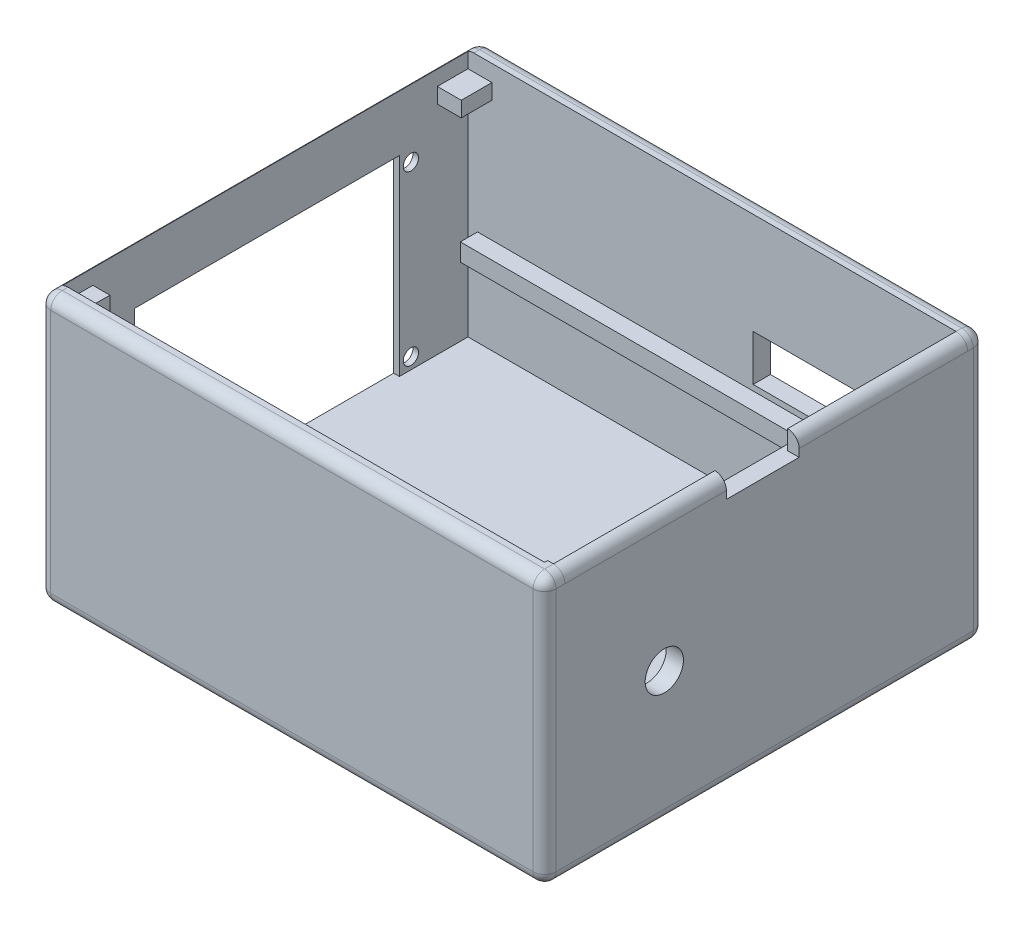
from build123d import *

# Parameters (mm, degrees)
SKETCH2_W           = 135
SKETCH2_H           = 115
SKETCH2_W_2         = 126
SKETCH2_H_2         = 106
BOSS_EXTRUDE1_DEPTH = 70
SKETCH2_2_W         = 126
SKETCH2_2_H         = 106
BOSS_EXTRUDE2_DEPTH = 5
SKETCH3_W           = 121
SKETCH3_H           = 4.584314329
BOSS_EXTRUDE3_DEPTH = 4.5
SKETCH3_3_W         = 35
SKETCH3_3_H         = 12
CUT_EXTRUDE1_DEPTH  = 148.195448299
SKETCH11_W          = 69.2
SKETCH11_H          = 50
SKETCH11_R          = 2
CUT_EXTRUDE3_DEPTH  = 26.5
SKETCH21_R          = 5
CUT_EXTRUDE7_DEPTH  = 10
SKETCH12_W          = 4.5
SKETCH12_H          = 105.171400209
CUT_EXTRUDE4_DEPTH  = 5
SKETCH15_W          = 115
SKETCH15_H          = 70
CUT_EXTRUDE6_DEPTH  = 3
SKETCH17_W          = 120.925170316
SKETCH17_H          = 4.5
BOSS_EXTRUDE5_DEPTH = 5.5
FILLET1_R           = 3
FILLET2_R           = 3
FILLET3_R           = 3
SKETCH22_W          = 3
SKETCH22_H          = 105.171400209
BOSS_EXTRUDE8_DEPTH = 5
SKETCH14_W          = 19
SKETCH14_H          = 5
CUT_EXTRUDE5_DEPTH  = 5
SKETCH19_W          = 6.24417403
SKETCH19_H          = 4
BOSS_EXTRUDE6_DEPTH = 8
SKETCH20_W          = 4.447751713
SKETCH20_H          = 10.321902288
BOSS_EXTRUDE7_DEPTH = 8
FILLET5_R           = 3
FILLET6_R           = 3


# Some blends are built 0.0001 mm under size
with BuildPart() as part:
    # Sketch2 → Boss-Extrude1 (new body)
    with BuildSketch(Plane(origin=(0, 0, 0), x_dir=(1, 0, 0), z_dir=(0, 1, 0))):
        Rectangle(SKETCH2_W, SKETCH2_H)
        Rectangle(SKETCH2_W_2, SKETCH2_H_2, mode=Mode.SUBTRACT)
    extrude(amount=BOSS_EXTRUDE1_DEPTH)

    # Sketch2<2> → Boss-Extrude2 (add)
    with BuildSketch(Plane(origin=(0, 0, 0), x_dir=(1, 0, 0), z_dir=(0, 1, 0))):
        Rectangle(SKETCH2_2_W, SKETCH2_2_H)
    extrude(amount=BOSS_EXTRUDE2_DEPTH)

    # Sketch3 → Boss-Extrude3 (add)
    with BuildSketch(Plane.XY.offset(-53)):
        with Locations((0, 27.707842836)):
            Rectangle(SKETCH3_W, SKETCH3_H)
    extrude(amount=BOSS_EXTRUDE3_DEPTH)

    # Sketch3<3> → Cut-Extrude1 (cut, through all)
    with BuildSketch(Plane.XY.offset(-53)):
        with Locations((29, 37.5)):
            Rectangle(SKETCH3_3_W, SKETCH3_3_H)
    extrude(amount=-CUT_EXTRUDE1_DEPTH, mode=Mode.SUBTRACT)

    # Sketch11 → Cut-Extrude3 (cut)
    with BuildSketch(Plane.ZY.offset(67.5)):
        with Locations((-0.5, 30)):
            Rectangle(SKETCH11_W, SKETCH11_H)
        with BuildLine():
            ThreePointArc((39.9, 8.871779789), (36.1, 8), (39.9, 7.128220211))
            Line((39.9, 7.128220211), (39.9, 8.871779789))
        make_face()
        with BuildLine():
            Line((39.9, 51.128220211), (39.9, 52.871779789))
            ThreePointArc((39.9, 52.871779789), (36.1, 52), (39.9, 51.128220211))
        make_face()
        with Locations((-38.1, 52)):
            Circle(SKETCH11_R)
        with Locations((-38.1, 8)):
            Circle(SKETCH11_R)
    extrude(amount=-CUT_EXTRUDE3_DEPTH, mode=Mode.SUBTRACT)

    # Sketch21 → Cut-Extrude7 (cut)
    with BuildSketch(Plane(origin=(67.5, 0, 0), x_dir=(0, 0, -1), z_dir=(1, 0, 0))):
        with Locations((-26.20929228, 34.316365245)):
            Circle(SKETCH21_R)
    extrude(amount=-CUT_EXTRUDE7_DEPTH, mode=Mode.SUBTRACT)

    # Sketch12 → Cut-Extrude4 (cut)
    with BuildSketch(Plane(origin=(0, 70, 0), x_dir=(1, 0, 0), z_dir=(0, 1, 0))):
        with Locations((65.25, 0.414299895)):
            Rectangle(SKETCH12_W, SKETCH12_H)
    extrude(amount=-CUT_EXTRUDE4_DEPTH, mode=Mode.SUBTRACT)

    # Sketch15 → Cut-Extrude6 (cut)
    with BuildSketch(Plane.ZY.offset(67.5)):
        with Locations((0, 35)):
            Rectangle(SKETCH15_W, SKETCH15_H)
    extrude(amount=-CUT_EXTRUDE6_DEPTH, mode=Mode.SUBTRACT)

    # Sketch17 → Boss-Extrude5 (add)
    with BuildSketch(Plane(origin=(0, 0, 53), x_dir=(-1, 0, 0), z_dir=(0, 0, -1))):
        with Locations((0.074904723, 27.75)):
            Rectangle(SKETCH17_W, SKETCH17_H)
    extrude(amount=BOSS_EXTRUDE5_DEPTH)

    # Fillet1
    fillet1_edges = [part.edges().sort_by_distance(p)[0] for p in [
        (1.5, 0, 57.5),
        (1.5, 0, -57.5),
        (67.5, 0, 0),
    ]]
    fillet(fillet1_edges, radius=FILLET1_R)

    # Fillet2
    # the kernel refuses this fillet: 3 mm, written as the material it takes off along each edge
    with BuildSketch(Plane(origin=(64.5, 3, 54.5), x_dir=(0, 0, 1), z_dir=(1, 0, 0))) as fillet2_piece_1_section:
        Polygon((0, 0), (FILLET2_R, 0), (FILLET2_R, FILLET2_R), (0, FILLET2_R), align=None)
    fillet2_piece_1 = extrude(amount=FILLET2_R, mode=Mode.PRIVATE)
    fillet2_piece_1 = fillet2_piece_1 - Plane(origin=(64.5, 3, 54.5), x_dir=(0, 0.7071067811865475, -0.7071067811865475), z_dir=(1, 0, 0)) * Sphere(FILLET2_R, mode=Mode.PRIVATE)
    add(fillet2_piece_1, mode=Mode.SUBTRACT)
    with BuildSketch(Plane(origin=(64.5, 3, -54.5), x_dir=(1, 0, 0), z_dir=(0, 0, -1))) as fillet2_piece_2_section:
        Polygon((0, 0), (FILLET2_R, 0), (FILLET2_R, FILLET2_R), (0, FILLET2_R), align=None)
    fillet2_piece_2 = extrude(amount=FILLET2_R, mode=Mode.PRIVATE)
    fillet2_piece_2 = fillet2_piece_2 - Plane(origin=(64.5, 3, -54.5), x_dir=(-0.7071067811865475, 0.7071067811865475, 0), z_dir=(0, 0, -1)) * Sphere(FILLET2_R, mode=Mode.PRIVATE)
    add(fillet2_piece_2, mode=Mode.SUBTRACT)
    with BuildSketch(Plane(origin=(-64.5, 77.5, -57.5), x_dir=(1, 0, 0), z_dir=(0, -1, 0)), Plane(origin=(67.5, 3, 57.5), x_dir=(0, 0, -1), z_dir=(0, 1, 0)), Plane(origin=(67.5, 3, -57.5), x_dir=(-1, 0, 0), z_dir=(0, 1, 0))) as fillet2_piece_3:
        with BuildLine():
            CenterArc((FILLET2_R, FILLET2_R), FILLET2_R, 180, 90)
            Line((0, FILLET2_R), (0, 0))
            Line((0, 0), (FILLET2_R, 0))
        make_face()
    extrude(amount=74.5, mode=Mode.SUBTRACT)
    with BuildSketch(Plane(origin=(-64.5, 0, -54.5), x_dir=(0, 1, 0), z_dir=(0, 0, 1))) as fillet2_piece_4:
        with BuildLine():
            CenterArc((FILLET2_R, -FILLET2_R), FILLET2_R, 90, 90)
            Line((0, -FILLET2_R), (0, 0))
            Line((0, 0), (FILLET2_R, 0))
        make_face()
    extrude(amount=109, mode=Mode.SUBTRACT)
    with BuildSketch(Plane(origin=(-64.5, 3, 57.5), x_dir=(0, 0, -1), z_dir=(0, 1, 0))) as fillet2_piece_5:
        with BuildLine():
            CenterArc((FILLET2_R, -FILLET2_R), FILLET2_R, 90, 90)
            Line((0, -FILLET2_R), (0, 0))
            Line((0, 0), (FILLET2_R, 0))
        make_face()
    extrude(amount=74.5, mode=Mode.SUBTRACT)
    with BuildSketch(Plane(origin=(-64.5, 3, -54.5), x_dir=(0, 0, -1), z_dir=(0, 1, 0))) as fillet2_piece_6:
        with BuildLine():
            CenterArc((3 - FILLET2_R, -FILLET2_R), FILLET2_R, 0, 90)
            Line((3 - FILLET2_R, 0), (3, 0))
            Line((3, 0), (3, -FILLET2_R))
        make_face()
    revolve(axis=Axis((-64.5, 3, -54.5), (-1, 0, 0)), revolution_arc=90, mode=Mode.SUBTRACT)
    with BuildSketch(Plane(origin=(-64.5, 3, 54.5), x_dir=(0, -1, 0), z_dir=(0, 0, -1))) as fillet2_piece_7:
        with BuildLine():
            CenterArc((3 - FILLET2_R, -FILLET2_R), FILLET2_R, 360, 90)
            Line((3, -FILLET2_R), (3, 0))
            Line((3, 0), (3 - FILLET2_R, 0))
        make_face()
    revolve(axis=Axis((-64.5, 3, 54.5), (-1, 0, 0)), revolution_arc=90, mode=Mode.SUBTRACT)

    # Fillet3
    # the kernel refuses this fillet: 3 mm, written as the material it takes off along each edge
    with BuildSketch(Plane(origin=(67.5, 70, -54.5), x_dir=(-1, 0, 0), z_dir=(0, 0, 1))) as fillet3_piece_1:
        with BuildLine():
            CenterArc((FILLET3_R, FILLET3_R), FILLET3_R, 180, 90)
            Line((0, FILLET3_R), (0, 0))
            Line((0, 0), (FILLET3_R, 0))
        make_face()
    extrude(amount=9, mode=Mode.SUBTRACT)
    with BuildSketch(Plane(origin=(64.5, 70, -54.5), x_dir=(0, 0, -1), z_dir=(-1, 0, 0))) as fillet3_piece_2:
        with BuildLine():
            CenterArc((3 - FILLET3_R, FILLET3_R), FILLET3_R, 270, 90)
            Line((3 - FILLET3_R, 0), (3, 0))
            Line((3, 0), (3, FILLET3_R))
        make_face()
    revolve(axis=Axis((64.5, 70, -54.5), (0, -1, 0)), revolution_arc=90, mode=Mode.SUBTRACT)
    with BuildSketch(Plane(origin=(-61.5, 70, -57.5), x_dir=(0, -1, 0), z_dir=(1, 0, 0))) as fillet3_piece_3:
        with BuildLine():
            CenterArc((FILLET3_R, -FILLET3_R), FILLET3_R, 90, 90)
            Line((0, -FILLET3_R), (0, 0))
            Line((0, 0), (FILLET3_R, 0))
        make_face()
    extrude(amount=126, mode=Mode.SUBTRACT)
    with BuildSketch(Plane(origin=(-61.5, 70, -54.5), x_dir=(0, 0, -1), z_dir=(1, 0, 0))) as fillet3_piece_4:
        with BuildLine():
            CenterArc((3 - FILLET3_R, -FILLET3_R), FILLET3_R, 0, 90)
            Line((3, -FILLET3_R), (3, 0))
            Line((3, 0), (3 - FILLET3_R, 0))
        make_face()
    revolve(axis=Axis((-61.5, 70, -54.5), (0, 1, 0)), revolution_arc=90, mode=Mode.SUBTRACT)
    with BuildSketch(Plane(origin=(-64.5, 70, 54.5), x_dir=(1, 0, 0), z_dir=(0, 0, -1))) as fillet3_piece_5:
        with BuildLine():
            CenterArc((FILLET3_R, FILLET3_R), FILLET3_R, 180, 90)
            Line((0, FILLET3_R), (0, 0))
            Line((0, 0), (FILLET3_R, 0))
        make_face()
    extrude(amount=109, mode=Mode.SUBTRACT)
    with BuildSketch(Plane(origin=(-61.5, 70, 54.5), x_dir=(0, 0, 1), z_dir=(1, 0, 0))) as fillet3_piece_6:
        with BuildLine():
            CenterArc((3 - FILLET3_R, FILLET3_R), FILLET3_R, 270, 90)
            Line((3, FILLET3_R), (3, 0))
            Line((3, 0), (3 - FILLET3_R, 0))
        make_face()
    revolve(axis=Axis((-61.5, 70, 54.5), (0, -1, 0)), revolution_arc=90, mode=Mode.SUBTRACT)
    with BuildSketch(Plane(origin=(64.5, 70, 57.5), x_dir=(0, 0, -1), z_dir=(-1, 0, 0))) as fillet3_piece_7:
        with BuildLine():
            CenterArc((FILLET3_R, FILLET3_R), FILLET3_R, 180, 90)
            Line((0, FILLET3_R), (0, 0))
            Line((0, 0), (FILLET3_R, 0))
        make_face()
    extrude(amount=126, mode=Mode.SUBTRACT)
    with BuildSketch(Plane(origin=(64.5, 70, 54.5), x_dir=(1, 0, 0), z_dir=(0, 0, -1))) as fillet3_piece_8:
        with BuildLine():
            CenterArc((3 - FILLET3_R, FILLET3_R), FILLET3_R, 270, 90)
            Line((3, FILLET3_R), (3, 0))
            Line((3, 0), (3 - FILLET3_R, 0))
        make_face()
    revolve(axis=Axis((64.5, 70, 54.5), (0, -1, 0)), revolution_arc=90, mode=Mode.SUBTRACT)
    with BuildSketch(Plane(origin=(67.5, 70, 44.671400209), x_dir=(-1, 0, 0), z_dir=(0, 0, 1))) as fillet3_piece_9:
        with BuildLine():
            CenterArc((FILLET3_R, FILLET3_R), FILLET3_R, 180, 90)
            Line((0, FILLET3_R), (0, 0))
            Line((0, 0), (FILLET3_R, 0))
        make_face()
    extrude(amount=9.828599791, mode=Mode.SUBTRACT)

    # Sketch22 → Boss-Extrude8 (add)
    with BuildSketch(Plane(origin=(0, 65, 0), x_dir=(1, 0, 0), z_dir=(0, 1, 0))):
        with Locations((66, 0.414299895)):
            Rectangle(SKETCH22_W, SKETCH22_H)
    extrude(amount=BOSS_EXTRUDE8_DEPTH)

    # Sketch14 → Cut-Extrude5 (cut)
    with BuildSketch(Plane(origin=(67.5, 0, 0), x_dir=(0, 0, -1), z_dir=(1, 0, 0))):
        with Locations((-0.5, 67.5)):
            Rectangle(SKETCH14_W, SKETCH14_H)
    extrude(amount=-CUT_EXTRUDE5_DEPTH, mode=Mode.SUBTRACT)

    # Sketch19 → Boss-Extrude6 (add)
    with BuildSketch(Plane.XY.offset(-53)):
        with Locations((-59.877912985, 63.669872981)):
            Rectangle(SKETCH19_W, SKETCH19_H)
    extrude(amount=BOSS_EXTRUDE6_DEPTH)

    # Sketch20 → Boss-Extrude7 (add)
    with BuildSketch(Plane(origin=(0, 0, 53), x_dir=(-1, 0, 0), z_dir=(0, 0, -1))):
        with Locations((60.776124144, 60.508921837)):
            Rectangle(SKETCH20_W, SKETCH20_H)
    extrude(amount=BOSS_EXTRUDE7_DEPTH)

    # Fillet5
    fillet5_edges = [part.edges().sort_by_distance(p)[0] for p in [
        (67.5, 70, 31.085700105),
    ]]
    fillet(fillet5_edges, radius=FILLET5_R - 0.0001)  # a hair under: the kernel refuses the full size

    # Fillet6
    fillet6_edges = [part.edges().sort_by_distance(p)[0] for p in [
        (67.5, 70, -31),
    ]]
    fillet(fillet6_edges, radius=FILLET6_R - 0.0001)  # a hair under: the kernel refuses the full size


solid = part.part
